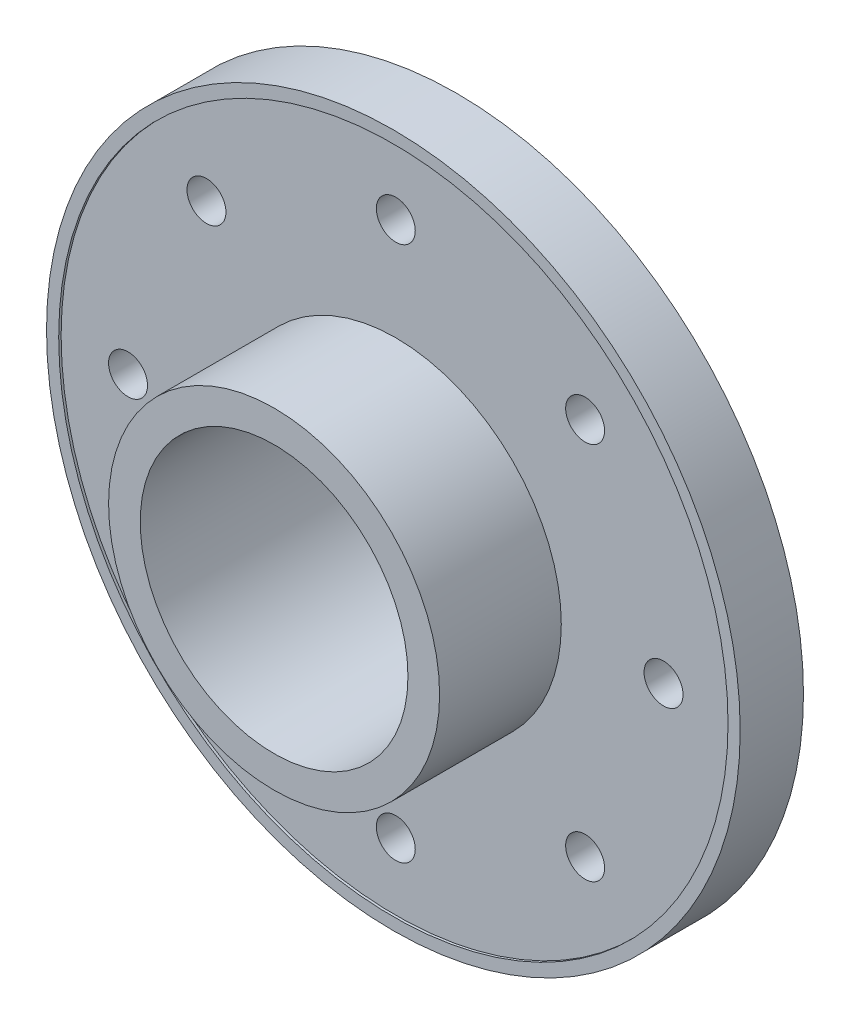
from build123d import *
from build123d.topology import SkipClean

# Parameters (mm, degrees)
SKETCH_1_R           = 27.5
EXTRUDE_1_DEPTH      = 4
SKETCH_2_R           = 11.1
CUT_EXTRUDE_1_DEPTH  = 4
SKETCH_3_R           = 13.6
EXTRUDE_3_DEPTH      = 20
SKETCH_6_R           = 11
CUT_EXTRUDE_3_DEPTH  = 20
SKETCH_7_R           = 1.6
CUT_EXTRUDE_4_DEPTH  = 20
EXTRUDE_START        = 10
EXTRUDE_4_DEPTH      = 10
CUT_EXTRUDE_5_DEPTH  = 100
SKETCH_11_R          = 11.1
SKETCH_11_R_2        = 11
EXTRUDE_6_DEPTH      = 4
SKETCH_12_R          = 2.800655953
SKETCH_12_R_2        = 3.373529329
SKETCH_12_R_3        = 2.364081435
EXTRUDE_7_DEPTH      = 4
SKETCH_13_R          = 1.6
CUT_EXTRUDE_6_DEPTH  = 4
EXTRUDE_8_DEPTH      = 10
SKETCH_15_W          = 10
SKETCH_15_H          = 32.528160092
CUT_EXTRUDE_7_DEPTH  = 50
EXTRUDE_9_DEPTH      = 10
CUT_EXTRUDE_8_DEPTH  = 50
CUT_EXTRUDE_START    = -1
SKETCH_19_R          = 27.5
SKETCH_19_R_2        = 13.6
CUT_EXTRUDE_9_DEPTH  = 1
SKETCH_20_R          = 2.7
CUT_EXTRUDE_10_DEPTH = 3
CUT_EXTRUDE_START_2  = -11
SKETCH_21_R          = 13.6
SKETCH_21_R_2        = 11
CUT_EXTRUDE_11_DEPTH = 11
EXTRUDE_START_2      = -23
SKETCH_22_R          = 13.6
SKETCH_22_R_2        = 11
EXTRUDE_12_DEPTH     = 23
EXTRUDE_START_3      = -3
SKETCH_23_R          = 2.7
EXTRUDE_13_DEPTH     = 3
EXTRUDE_START_4      = 2
SKETCH_25_R          = 27.5
SKETCH_25_R_2        = 13.6
SKETCH_25_R_3        = 1.6
EXTRUDE_14_DEPTH     = 2
EXTRUDE_START_5      = -5
SKETCH_26_R          = 28.5
SKETCH_26_R_2        = 27.5
EXTRUDE_15_DEPTH     = 5
SKETCH_28_R          = 28.5
SKETCH_28_R_2        = 27.5
EXTRUDE_16_DEPTH     = 0.2


with BuildPart() as part:
    # 草图1 → 凸台-拉伸1 (new body)
    with BuildSketch(Plane.XY):
        Circle(SKETCH_1_R)
    extrude(amount=EXTRUDE_1_DEPTH)

    # 草图2 → 切除-拉伸1 (cut)
    with BuildSketch(Plane(origin=(0, 0, 0), x_dir=(-1, 0, 0), z_dir=(0, 0, -1))):
        Circle(SKETCH_2_R)
    extrude(amount=-CUT_EXTRUDE_1_DEPTH, mode=Mode.SUBTRACT)

    # 草图3 → 凸台-拉伸3 (add)
    with BuildSketch(Plane.XY.offset(4)):
        Circle(SKETCH_3_R)
    extrude(amount=EXTRUDE_3_DEPTH)

    # 草图6 → 切除-拉伸3 (cut)
    with BuildSketch(Plane(origin=(0, 0, 4), x_dir=(-1, 0, 0), z_dir=(0, 0, -1))):
        Circle(SKETCH_6_R)
    extrude(amount=-CUT_EXTRUDE_3_DEPTH, mode=Mode.SUBTRACT)

    # 草图7 → 切除-拉伸4 (cut)
    with BuildSketch(Plane(origin=(0, 0, 0), x_dir=(-1, 0, 0), z_dir=(0, 0, -1))):
        with Locations((22, 0)):
            Circle(SKETCH_7_R)
        with Locations((-22, 0)):
            Circle(SKETCH_7_R)
        with Locations((16.284780052, 14.752245396)):
            Circle(SKETCH_7_R)
    extrude(amount=-CUT_EXTRUDE_4_DEPTH, mode=Mode.SUBTRACT)

    # 草图8 → 凸台-拉伸4 (add)
    with SkipClean():  # the faces are left unmerged after this step: merging them gives an invalid solid
        with BuildSketch(Plane(origin=(0, 0, 0), x_dir=(-1, 0, 0), z_dir=(0, 0, -1)).offset(EXTRUDE_START)):
            with BuildLine():
                ThreePointArc((22, 14.773286703), (26.5, 0), (22, -14.773286703))
                Line((22, -14.773286703), (22.830188679, -15.33076922))
                ThreePointArc((22.830188679, -15.33076922), (26.306654944, -8.013108364), (27.5, 0))
                ThreePointArc((27.5, 0), (26.306654944, 8.013108364), (22.830188679, 15.33076922))
                Line((22.830188679, 15.33076922), (22, 14.773286703))
            make_face()
        extrude(amount=-EXTRUDE_4_DEPTH)

    # 草图10 → 切除-拉伸5 (cut)
    with SkipClean():  # the faces are left unmerged after this step: merging them gives an invalid solid
        with BuildSketch(Plane(origin=(0, 0, 0), x_dir=(0, 0, -1), z_dir=(1, 0, 0))):
            Polygon((10, 15.33076922), (2.5, 15.33076922), (10, 0), align=None)
            Polygon((10, -15.33076922), (10, 0), (2.5, -15.33076922), align=None)
        extrude(amount=-CUT_EXTRUDE_5_DEPTH, mode=Mode.SUBTRACT)

    # 草图11 → 凸台-拉伸6 (add)
    with SkipClean():  # the faces are left unmerged after this step: merging them gives an invalid solid
        with BuildSketch(Plane(origin=(0, 0, 0), x_dir=(-1, 0, 0), z_dir=(0, 0, -1))):
            Circle(SKETCH_11_R)
            Circle(SKETCH_11_R_2, mode=Mode.SUBTRACT)
        extrude(amount=-EXTRUDE_6_DEPTH)

    # 草图12 → 凸台-拉伸7 (add)
    with SkipClean():  # the faces are left unmerged after this step: merging them gives an invalid solid
        with BuildSketch(Plane(origin=(0, 0, 0), x_dir=(-1, 0, 0), z_dir=(0, 0, -1))):
            with Locations((16.284780052, 14.752245396)):
                Circle(SKETCH_12_R)
            with Locations((22, 0)):
                Circle(SKETCH_12_R_2)
            with Locations((-22, 0)):
                Circle(SKETCH_12_R_3)
        extrude(amount=-EXTRUDE_7_DEPTH)

    # 草图13 → 切除-拉伸6 (cut)
    with SkipClean():  # the faces are left unmerged after this step: merging them gives an invalid solid
        with BuildSketch(Plane(origin=(0, 0, 0), x_dir=(-1, 0, 0), z_dir=(0, 0, -1))):
            with Locations((0, 22)):
                Circle(SKETCH_13_R)
            with Locations((15.556349186, 15.556349186)):
                Circle(SKETCH_13_R)
            with Locations((22, 0)):
                Circle(SKETCH_13_R)
            with Locations((15.556349186, -15.556349186)):
                Circle(SKETCH_13_R)
            with Locations((0, -22)):
                Circle(SKETCH_13_R)
            with Locations((-15.556349186, -15.556349186)):
                Circle(SKETCH_13_R)
            with Locations((-22, 0)):
                Circle(SKETCH_13_R)
            with Locations((-15.556349186, 15.556349186)):
                Circle(SKETCH_13_R)
        extrude(amount=-CUT_EXTRUDE_6_DEPTH, mode=Mode.SUBTRACT)

    # 草图14 → 凸台-拉伸8 (add)
    with SkipClean():  # the faces are left unmerged after this step: merging them gives an invalid solid
        with BuildSketch(Plane(origin=(0, 0, 0), x_dir=(-1, 0, 0), z_dir=(0, 0, -1))):
            Polygon((0, 0), (0, 15.773120627), (1.766615934, 15.773120627), (1.766615934, -16.755039465), (0, -16.755039465), align=None)
        extrude(amount=EXTRUDE_8_DEPTH)

    # 草图15 → 切除-拉伸7 (cut)
    with BuildSketch(Plane(origin=(0, 0, 0), x_dir=(0, 0, -1), z_dir=(1, 0, 0))):
        with Locations((5, -0.490959419)):
            Rectangle(SKETCH_15_W, SKETCH_15_H)
    extrude(amount=-CUT_EXTRUDE_7_DEPTH, mode=Mode.SUBTRACT)

    # 草图16 → 凸台-拉伸9 (add)
    with SkipClean():  # the faces are left unmerged after this step: merging them gives an invalid solid
        with BuildSketch(Plane(origin=(0, 0, 0), x_dir=(-1, 0, 0), z_dir=(0, 0, -1)).offset(EXTRUDE_START)):
            with BuildLine():
                ThreePointArc((22.8, 12.496399481), (26, 0), (22.8, -12.496399481))
                Line((22.8, -12.496399481), (24.115384615, -13.217345605))
                ThreePointArc((24.115384615, -13.217345605), (26.640411755, -6.821910402), (27.5, 0))
                ThreePointArc((27.5, 0), (26.640411755, 6.821910402), (24.115384615, 13.217345605))
                Line((24.115384615, 13.217345605), (22.8, 12.496399481))
            make_face()
        extrude(amount=-EXTRUDE_9_DEPTH)

    # 草图18 → 切除-拉伸8 (cut)
    with SkipClean():  # the faces are left unmerged after this step: merging them gives an invalid solid
        with BuildSketch(Plane(origin=(0, 0, 0), x_dir=(0, 0, -1), z_dir=(1, 0, 0))):
            Polygon((10, 13.217345605), (2.5, 13.217345605), (10, 0), align=None)
            Polygon((10, -13.217345605), (10, 0), (2.5, -13.217345605), align=None)
        extrude(amount=-CUT_EXTRUDE_8_DEPTH, mode=Mode.SUBTRACT)

    # 草图19 → 切除-拉伸9 (cut)
    with SkipClean():  # the faces are left unmerged after this step: merging them gives an invalid solid
        with BuildSketch(Plane.XY.offset(4).offset(CUT_EXTRUDE_START)):
            Circle(SKETCH_19_R)
            Circle(SKETCH_19_R_2, mode=Mode.SUBTRACT)
        extrude(amount=CUT_EXTRUDE_9_DEPTH, mode=Mode.SUBTRACT)

    # 草图20 → 切除-拉伸10 (cut)
    with SkipClean():  # the faces are left unmerged after this step: merging them gives an invalid solid
        with BuildSketch(Plane(origin=(0, 0, 0), x_dir=(-1, 0, 0), z_dir=(0, 0, -1))):
            with Locations((16.167891819, 6.696960066)):
                Circle(SKETCH_20_R)
            with Locations((-13.883683455, 10.653325008)):
                Circle(SKETCH_20_R)
            with Locations((-2.284208364, -17.350285074)):
                Circle(SKETCH_20_R)
        extrude(amount=-CUT_EXTRUDE_10_DEPTH, mode=Mode.SUBTRACT)

    # 草图21 → 切除-拉伸11 (cut)
    with SkipClean():  # the faces are left unmerged after this step: merging them gives an invalid solid
        with BuildSketch(Plane.XY.offset(24).offset(CUT_EXTRUDE_START_2)):
            Circle(SKETCH_21_R)
            Circle(SKETCH_21_R_2, mode=Mode.SUBTRACT)
        extrude(amount=CUT_EXTRUDE_11_DEPTH, mode=Mode.SUBTRACT)

    # 草图22 → 凸台-拉伸12 (add)
    with SkipClean():  # the faces are left unmerged after this step: merging them gives an invalid solid
        with BuildSketch(Plane.XY.offset(13).offset(EXTRUDE_START_2)):
            Circle(SKETCH_22_R)
            Circle(SKETCH_22_R_2, mode=Mode.SUBTRACT)
        extrude(amount=EXTRUDE_12_DEPTH)

    # 草图23 → 凸台-拉伸13 (add)
    with SkipClean():  # the faces are left unmerged after this step: merging them gives an invalid solid
        with BuildSketch(Plane.XY.offset(3).offset(EXTRUDE_START_3)):
            with Locations((-16.167891819, 6.696960066)):
                Circle(SKETCH_23_R)
            with Locations((13.883683455, 10.653325008)):
                Circle(SKETCH_23_R)
            with Locations((2.284208364, -17.350285074)):
                Circle(SKETCH_23_R)
        extrude(amount=EXTRUDE_13_DEPTH)

    # 草图25 → 凸台-拉伸14 (add)
    with SkipClean():  # the faces are left unmerged after this step: merging them gives an invalid solid
        with BuildSketch(Plane(origin=(0, 0, 0), x_dir=(-1, 0, 0), z_dir=(0, 0, -1)).offset(EXTRUDE_START_4)):
            Circle(SKETCH_25_R)
            Circle(SKETCH_25_R_2, mode=Mode.SUBTRACT)
            with Locations((0, 22)):
                Circle(SKETCH_25_R_3, mode=Mode.SUBTRACT)
            with Locations((-15.556349186, 15.556349186)):
                Circle(SKETCH_25_R_3, mode=Mode.SUBTRACT)
            with Locations((-22, 0)):
                Circle(SKETCH_25_R_3, mode=Mode.SUBTRACT)
            with Locations((-15.556349186, -15.556349186)):
                Circle(SKETCH_25_R_3, mode=Mode.SUBTRACT)
            with Locations((0, -22)):
                Circle(SKETCH_25_R_3, mode=Mode.SUBTRACT)
            with Locations((15.556349186, -15.556349186)):
                Circle(SKETCH_25_R_3, mode=Mode.SUBTRACT)
            with Locations((22, 0)):
                Circle(SKETCH_25_R_3, mode=Mode.SUBTRACT)
            with Locations((15.556349186, 15.556349186)):
                Circle(SKETCH_25_R_3, mode=Mode.SUBTRACT)
        extrude(amount=-EXTRUDE_14_DEPTH)

    # 草图26 → 凸台-拉伸15 (add)
    with BuildSketch(Plane.XY.offset(3).offset(EXTRUDE_START_5)):
        Circle(SKETCH_26_R)
        Circle(SKETCH_26_R_2, mode=Mode.SUBTRACT)
    extrude(amount=EXTRUDE_15_DEPTH)

    # 草图28 → 凸台-拉伸16 (add)
    with BuildSketch(Plane.XY.offset(3)):
        Circle(SKETCH_28_R)
        Circle(SKETCH_28_R_2, mode=Mode.SUBTRACT)
    extrude(amount=EXTRUDE_16_DEPTH)


solid = part.part
